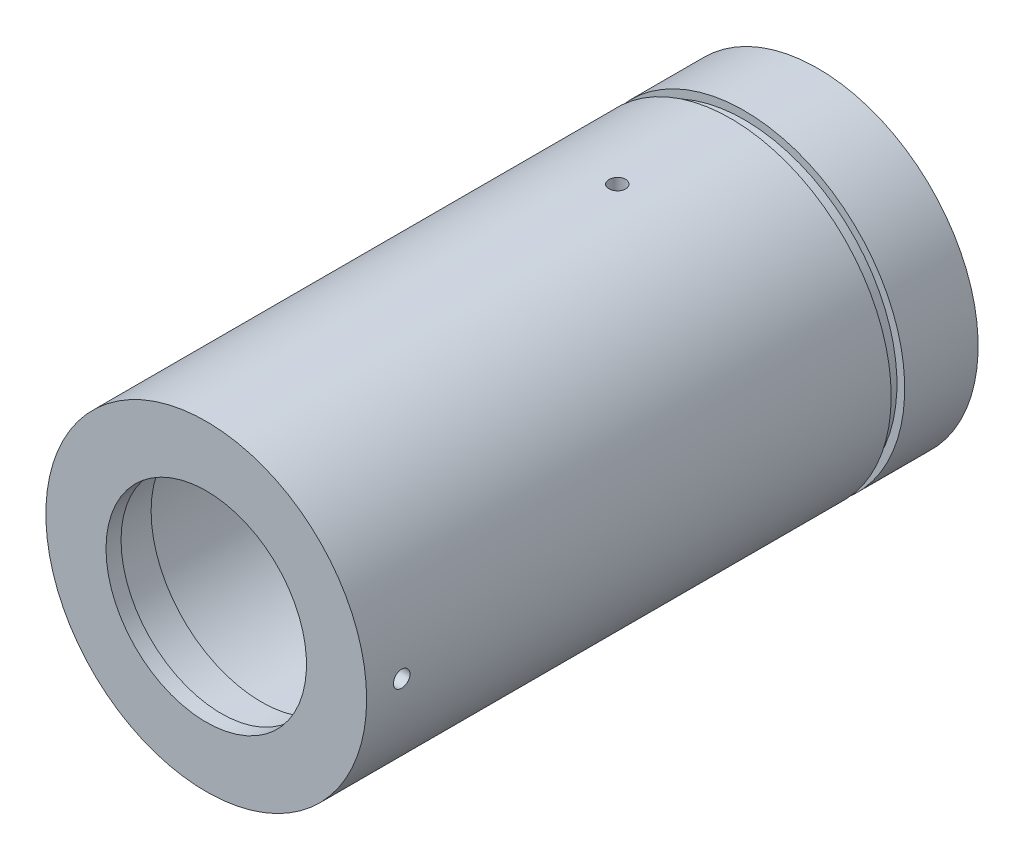
from build123d import *

# Parameters (mm, degrees)
SKETCH1_R            = 32
BODY_DEPTH           = 122
SKETCH2_R            = 20
LIP_BORE_DEPTH       = 122
SKETCH3_R            = 22
BRIDGE_SEAT_DEPTH    = 119
SKETCH4_R            = 25
HOPPER_DEPTH         = 111
SKETCH5_R            = 27
BURR_SEAT_DEPTH      = 50
SKETCH6_R            = 28
PILOT_SEAT_DEPTH     = 30
SKETCH7_R            = 28.46
THREAD_MINOR_DEPTH   = 10
SKETCH8_R            = 29.5
THREAD_RELIEF_DEPTH  = 2
SKETCH9_R            = 33
SKETCH9_R_2          = 30.45
ORING_GROOVE_DEPTH   = 2.7
SKETCH10_R           = 1.65
BURR_SCREW_90_DEPTH  = 6
SKETCH11_R           = 1.65
BURR_SCREW_270_DEPTH = 6
SKETCH12_R           = 1.65
BRIDGE_SCREW_DEPTH   = 11
SKETCH13_R           = 2.5
PLUNGER_HOLE_DEPTH   = 5


with BuildPart() as part:
    # Sketch1 → Body (new body)
    with BuildSketch(Plane.XY):
        Circle(SKETCH1_R)
    extrude(amount=BODY_DEPTH)

    # Sketch2 → Lip_bore (cut)
    with BuildSketch(Plane.XY):
        Circle(SKETCH2_R)
    extrude(amount=LIP_BORE_DEPTH, mode=Mode.SUBTRACT)

    # Sketch3 → Bridge_seat (cut)
    with BuildSketch(Plane.XY):
        Circle(SKETCH3_R)
    extrude(amount=BRIDGE_SEAT_DEPTH, mode=Mode.SUBTRACT)

    # Sketch4 → Hopper (cut)
    with BuildSketch(Plane.XY):
        Circle(SKETCH4_R)
    extrude(amount=HOPPER_DEPTH, mode=Mode.SUBTRACT)

    # Sketch5 → Burr_seat (cut)
    with BuildSketch(Plane.XY):
        Circle(SKETCH5_R)
    extrude(amount=BURR_SEAT_DEPTH, mode=Mode.SUBTRACT)

    # Sketch6 → Pilot_seat (cut)
    with BuildSketch(Plane.XY):
        Circle(SKETCH6_R)
    extrude(amount=PILOT_SEAT_DEPTH, mode=Mode.SUBTRACT)

    # Sketch7 → Thread_minor (cut)
    with BuildSketch(Plane.XY):
        Circle(SKETCH7_R)
    extrude(amount=THREAD_MINOR_DEPTH, mode=Mode.SUBTRACT)

    # Sketch8 → Thread_relief (cut)
    with BuildSketch(Plane.XY.offset(10)):
        Circle(SKETCH8_R)
    extrude(amount=THREAD_RELIEF_DEPTH, mode=Mode.SUBTRACT)

    # Sketch9 → Oring_groove (cut)
    with BuildSketch(Plane.XY.offset(14.65)):
        Circle(SKETCH9_R)
        Circle(SKETCH9_R_2, mode=Mode.SUBTRACT)
    extrude(amount=ORING_GROOVE_DEPTH, mode=Mode.SUBTRACT)

    # Sketch10 → Burr_screw_90 (cut)
    with BuildSketch(Plane(origin=(0, 26.5, 0), x_dir=(1, 0, 0), z_dir=(0, 1, 0))):
        with Locations((0, -40)):
            Circle(SKETCH10_R)
    extrude(amount=BURR_SCREW_90_DEPTH, mode=Mode.SUBTRACT)

    # Sketch11 → Burr_screw_270 (cut)
    with BuildSketch(Plane(origin=(0, -32.5, 0), x_dir=(1, 0, 0), z_dir=(0, 1, 0))):
        with Locations((0, -40)):
            Circle(SKETCH11_R)
    extrude(amount=BURR_SCREW_270_DEPTH, mode=Mode.SUBTRACT)

    # Sketch12 → Bridge_screw (cut)
    with BuildSketch(Plane(origin=(21.5, 0, 0), x_dir=(0, 0, -1), z_dir=(1, 0, 0))):
        with Locations((-115, 0)):
            Circle(SKETCH12_R)
    extrude(amount=BRIDGE_SCREW_DEPTH, mode=Mode.SUBTRACT)

    # Sketch13 → Plunger_hole (cut)
    with BuildSketch(Plane(origin=(-32.5, 0, 0), x_dir=(0, 0, -1), z_dir=(1, 0, 0))):
        with Locations((-22, 0)):
            Circle(SKETCH13_R)
    extrude(amount=PLUNGER_HOLE_DEPTH, mode=Mode.SUBTRACT)


solid = part.part
